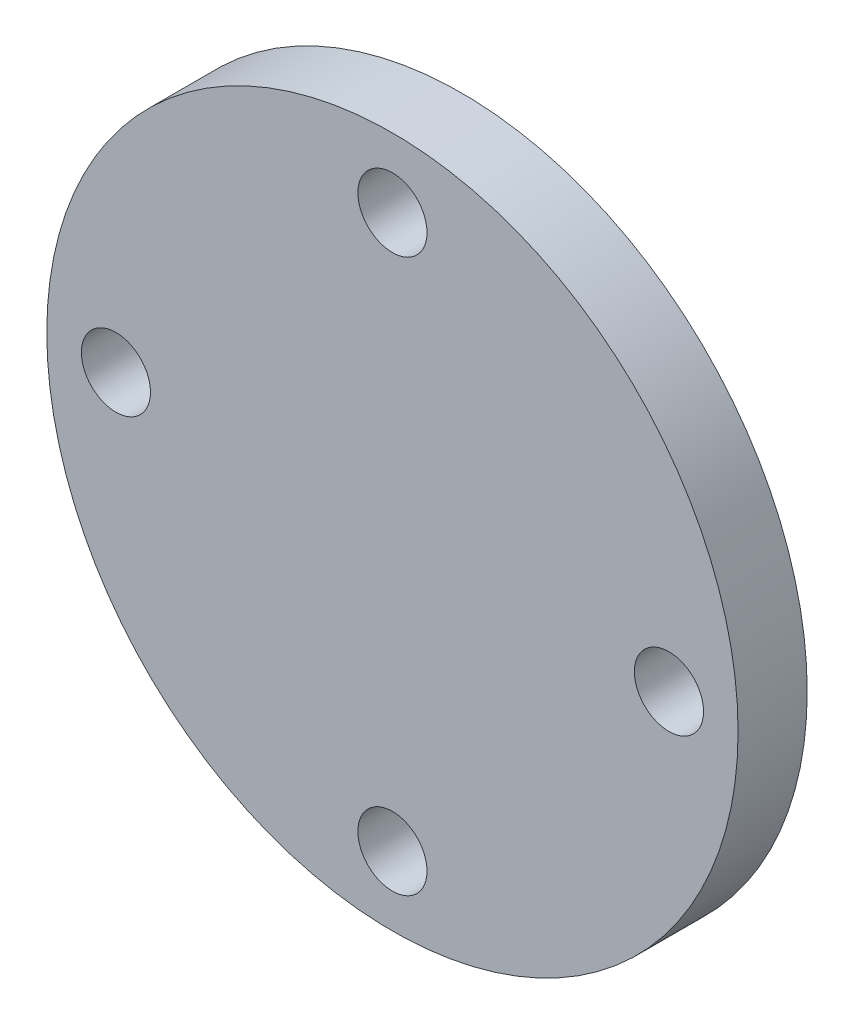
from build123d import *

# Parameters (mm, degrees)
SKETCH1_R           = 100
BOSS_EXTRUDE1_DEPTH = 20
HOLE1_START         = 2
HOLE1_OUTLINE_R     = 10
HOLE1_DEPTH         = 18


# Read off the part's stored shape, not the designer's step: Hole1
with BuildPart() as part:
    # Sketch1 → Boss-Extrude1 (new body)
    with BuildSketch(Plane(origin=(0, 0, 0), x_dir=(0, 1, 0), z_dir=(0, 0, 1))):
        with Locations(Location((0, 0, 0), (0, 0, 270))):
            Circle(SKETCH1_R)
    extrude(amount=BOSS_EXTRUDE1_DEPTH)

    # Hole1 outline → Hole1 (cut)
    with BuildSketch(Plane.XY.offset(HOLE1_START)):
        with Locations((-80, 0)):
            Circle(HOLE1_OUTLINE_R)
        with Locations((0, -80)):
            Circle(HOLE1_OUTLINE_R)
        with Locations((0, 80)):
            Circle(HOLE1_OUTLINE_R)
        with Locations((80, 0)):
            Circle(HOLE1_OUTLINE_R)
    extrude(amount=HOLE1_DEPTH, mode=Mode.SUBTRACT)


solid = part.part
